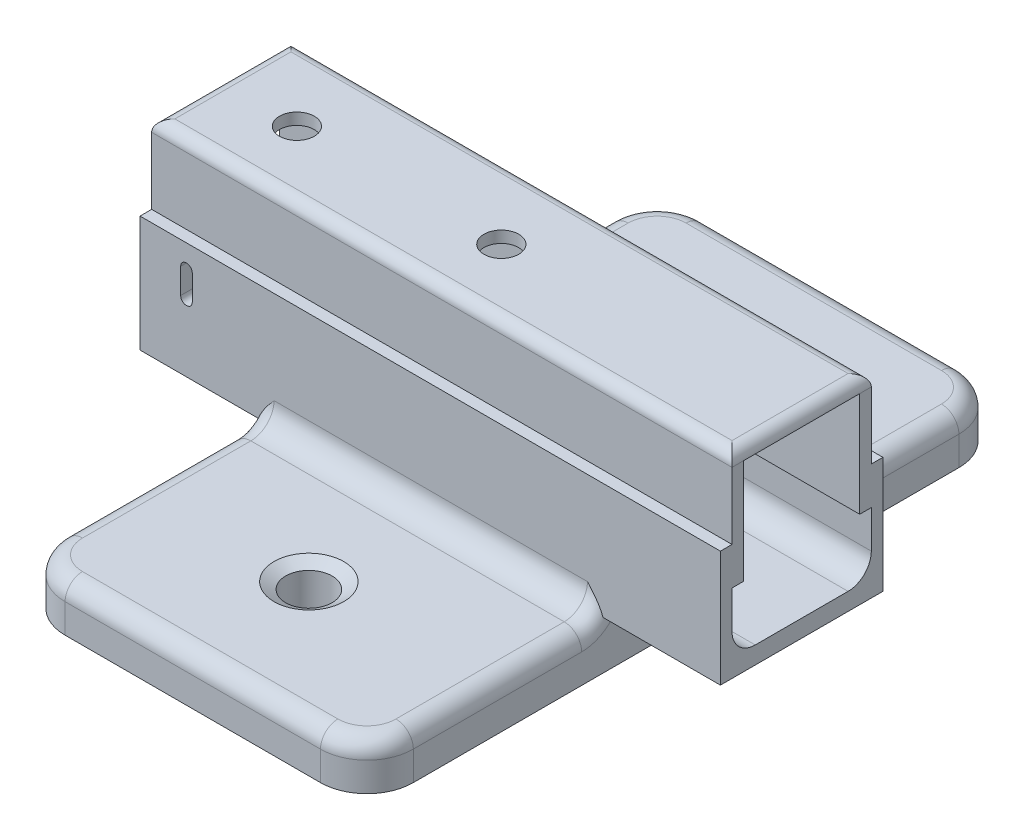
from build123d import *
from OCP.BRepFilletAPI import BRepFilletAPI_MakeChamfer

# Parameters (mm, degrees)
BOSS_EXTRUDE1_DEPTH = 4
SKETCH3_W           = 50
SKETCH3_H           = 1
BOSS_EXTRUDE2_DEPTH = 10
BOSS_EXTRUDE3_START = -13
SKETCH4_W           = 50
SKETCH4_H           = 1.5
BOSS_EXTRUDE3_DEPTH = 12
FILLET1_R           = 2
FILLET2_R           = 2
FILLET3_R           = 2
FILLET4_R           = 1.5
BOSS_EXTRUDE4_DEPTH = 50
FILLET6_START       = -40.045040573
FILLET6_DEPTH       = 50
FILLET6_START_2     = -34.5
FILLET6_2_DEPTH     = 14
SKETCH6_R           = 1.5
CUT_EXTRUDE1_DEPTH  = 2
SKETCH8_R           = 2
CUT_EXTRUDE2_DEPTH  = 10
CHAMFER1_SIZE       = 1
CHAMFER1_SIZE2      = 0.577350269
CUT_EXTRUDE3_DEPTH  = 57.783957087


with BuildPart() as part:
    # Sketch1 → Boss-Extrude1 (new body)
    with BuildSketch(Plane(origin=(0, 0, 0), x_dir=(1, 0, 0), z_dir=(0, 1, 0))):
        with BuildLine():
            Line((-4, 0), (-26, 0))
            ThreePointArc((-26, 0), (-28.828427125, 1.171572875), (-30, 4))
            Line((-30, 4), (-30, 51))
            ThreePointArc((-30, 51), (-28.828427125, 53.828427125), (-26, 55))
            Line((-26, 55), (-4, 55))
            ThreePointArc((-4, 55), (-1.171572875, 53.828427125), (0, 51))
            Line((0, 51), (0, 4))
            ThreePointArc((0, 4), (-1.171572875, 1.171572875), (-4, 0))
        make_face()
    extrude(amount=BOSS_EXTRUDE1_DEPTH)

    # Sketch3 → Boss-Extrude2 (add)
    with BuildSketch(Plane(origin=(0, 4, 0), x_dir=(1, 0, 0), z_dir=(0, 1, 0))):
        with Locations((-15.045040573, 21)):
            Rectangle(SKETCH3_W, SKETCH3_H)
        with Locations((-15.045040573, 34)):
            Rectangle(SKETCH3_W, SKETCH3_H)
    extrude(amount=BOSS_EXTRUDE2_DEPTH)

    # Sketch4 → Boss-Extrude3 (add)
    with BuildSketch(Plane(origin=(0, 0, -34.5), x_dir=(-1, 0, 0), z_dir=(0, 0, -1)).offset(BOSS_EXTRUDE3_START)):
        with Locations((15.045040573, 4.75)):
            Rectangle(SKETCH4_W, SKETCH4_H)
    extrude(amount=BOSS_EXTRUDE3_DEPTH)

    # Fillet1
    fillet1_edges = [part.edges().sort_by_distance(p)[0] for p in [
        (-15, 4, -20.5),
    ]]
    fillet(fillet1_edges, radius=FILLET1_R)

    # Fillet2
    fillet2_edges = [part.edges().sort_by_distance(p)[0] for p in [
        (-15, 4, -34.5),
    ]]
    fillet(fillet2_edges, radius=FILLET2_R)

    # Fillet3
    fillet3_edges = [part.edges().sort_by_distance(p)[0] for p in [
        (-15.045040573, 5.5, -33.5),
        (-15.045040573, 5.5, -21.5),
    ]]
    fillet(fillet3_edges, radius=FILLET3_R)

    # Fillet4
    # the kernel refuses this fillet: 1.5 mm, written as the material it takes off along each edge
    with BuildSketch(Plane(origin=(0, 6, -36.5), x_dir=(0, -1, 0), z_dir=(0, 0, -1))) as fillet4_piece_1_section:
        with BuildLine():
            CenterArc((2 + FILLET4_R, FILLET4_R), FILLET4_R, 180, 90)
            Line((2 + FILLET4_R, 0), (2, 0))
            Line((2, 0), (2, FILLET4_R))
        make_face()
    fillet4_piece_1 = revolve(axis=Axis((0, 6, -36.5), (-1, 0, 0)), revolution_arc=197.472741928, mode=Mode.PRIVATE)
    fillet4_piece_1 = split(fillet4_piece_1, bisect_by=Plane(origin=(0, 6, -34.5), z_dir=(0, 0, -1)), keep=Keep.TOP, mode=Mode.PRIVATE)
    add(fillet4_piece_1, mode=Mode.SUBTRACT)
    with BuildSketch(Plane(origin=(0, 6, -36.5), x_dir=(0, -1, 0), z_dir=(0, 0, -1))) as fillet4_piece_2_section:
        with BuildLine():
            CenterArc((2 + FILLET4_R, FILLET4_R), FILLET4_R, 180, 90)
            Line((2 + FILLET4_R, 0), (2, 0))
            Line((2, 0), (2, FILLET4_R))
        make_face()
    fillet4_piece_2 = revolve(axis=Axis((0, 6, -36.5), (-1, 0, 0)), revolution_arc=197.472741928, mode=Mode.PRIVATE)
    fillet4_piece_2 = split(fillet4_piece_2, bisect_by=Plane(origin=(0, 4, -36.5), z_dir=(0, -1, 0)), keep=Keep.TOP, mode=Mode.PRIVATE)
    add(fillet4_piece_2, mode=Mode.SUBTRACT)
    with BuildSketch(Plane(origin=(-30, 6, -36.5), x_dir=(0, -1, 0), z_dir=(0, 0, -1))) as fillet4_piece_3_section:
        with BuildLine():
            CenterArc((2 + FILLET4_R, -FILLET4_R), FILLET4_R, 90, 90)
            Line((2, -FILLET4_R), (2, 0))
            Line((2, 0), (2 + FILLET4_R, 0))
        make_face()
    fillet4_piece_3 = revolve(axis=Axis((-30, 6, -36.5), (-1, 0, 0)), revolution_arc=197.472741928, mode=Mode.PRIVATE)
    fillet4_piece_3 = split(fillet4_piece_3, bisect_by=Plane(origin=(-30, 4, -36.5), z_dir=(0, -1, 0)), keep=Keep.TOP, mode=Mode.PRIVATE)
    add(fillet4_piece_3, mode=Mode.SUBTRACT)
    with BuildSketch(Plane(origin=(-30, 6, -36.5), x_dir=(0, -1, 0), z_dir=(0, 0, -1))) as fillet4_piece_4_section:
        with BuildLine():
            CenterArc((2 + FILLET4_R, -FILLET4_R), FILLET4_R, 90, 90)
            Line((2, -FILLET4_R), (2, 0))
            Line((2, 0), (2 + FILLET4_R, 0))
        make_face()
    fillet4_piece_4 = revolve(axis=Axis((-30, 6, -36.5), (-1, 0, 0)), revolution_arc=197.472741928, mode=Mode.PRIVATE)
    fillet4_piece_4 = split(fillet4_piece_4, bisect_by=Plane(origin=(-30, 6, -34.5), z_dir=(0, 0, -1)), keep=Keep.TOP, mode=Mode.PRIVATE)
    add(fillet4_piece_4, mode=Mode.SUBTRACT)
    with BuildSketch(Plane(origin=(-30, 6, -18.5), x_dir=(0, 0.9538599015249878, 0.30025204122993193), z_dir=(0, -0.30025204122993193, 0.9538599015249878))) as fillet4_piece_5_section:
        with BuildLine():
            CenterArc((2 + FILLET4_R, -FILLET4_R), FILLET4_R, 90, 90)
            Line((2, -FILLET4_R), (2, 0))
            Line((2, 0), (2 + FILLET4_R, 0))
        make_face()
    fillet4_piece_5 = revolve(axis=Axis((-30, 6, -18.5), (-1, 0, 0)), revolution_arc=197.472741928, mode=Mode.PRIVATE)
    fillet4_piece_5 = split(fillet4_piece_5, bisect_by=Plane(origin=(-30, 6, -20.5), z_dir=(0, 0, 1)), keep=Keep.TOP, mode=Mode.PRIVATE)
    add(fillet4_piece_5, mode=Mode.SUBTRACT)
    with BuildSketch(Plane(origin=(-30, 6, -18.5), x_dir=(0, 0.9538599015249878, 0.30025204122993193), z_dir=(0, -0.30025204122993193, 0.9538599015249878))) as fillet4_piece_6_section:
        with BuildLine():
            CenterArc((2 + FILLET4_R, -FILLET4_R), FILLET4_R, 90, 90)
            Line((2, -FILLET4_R), (2, 0))
            Line((2, 0), (2 + FILLET4_R, 0))
        make_face()
    fillet4_piece_6 = revolve(axis=Axis((-30, 6, -18.5), (-1, 0, 0)), revolution_arc=197.472741928, mode=Mode.PRIVATE)
    fillet4_piece_6 = split(fillet4_piece_6, bisect_by=Plane(origin=(-30, 4, -18.5), z_dir=(0, -1, 0)), keep=Keep.TOP, mode=Mode.PRIVATE)
    add(fillet4_piece_6, mode=Mode.SUBTRACT)
    with BuildSketch(Plane(origin=(0, 6, -18.5), x_dir=(0, 0.9538599015249878, 0.3002520412299318), z_dir=(0, -0.3002520412299318, 0.9538599015249878))) as fillet4_piece_7_section:
        with BuildLine():
            CenterArc((2 + FILLET4_R, FILLET4_R), FILLET4_R, 180, 90)
            Line((2, FILLET4_R), (2, 0))
            Line((2, 0), (2 + FILLET4_R, 0))
        make_face()
    fillet4_piece_7 = revolve(axis=Axis((0, 6, -18.5), (-1, 0, 0)), revolution_arc=197.472741928, mode=Mode.PRIVATE)
    fillet4_piece_7 = split(fillet4_piece_7, bisect_by=Plane(origin=(0, 6, -20.5), z_dir=(0, 0, 1)), keep=Keep.TOP, mode=Mode.PRIVATE)
    add(fillet4_piece_7, mode=Mode.SUBTRACT)
    with BuildSketch(Plane(origin=(0, 6, -18.5), x_dir=(0, 0.9538599015249878, 0.3002520412299318), z_dir=(0, -0.3002520412299318, 0.9538599015249878))) as fillet4_piece_8_section:
        with BuildLine():
            CenterArc((2 + FILLET4_R, FILLET4_R), FILLET4_R, 180, 90)
            Line((2, FILLET4_R), (2, 0))
            Line((2, 0), (2 + FILLET4_R, 0))
        make_face()
    fillet4_piece_8 = revolve(axis=Axis((0, 6, -18.5), (-1, 0, 0)), revolution_arc=197.472741928, mode=Mode.PRIVATE)
    fillet4_piece_8 = split(fillet4_piece_8, bisect_by=Plane(origin=(0, 4, -18.5), z_dir=(0, -1, 0)), keep=Keep.TOP, mode=Mode.PRIVATE)
    add(fillet4_piece_8, mode=Mode.SUBTRACT)
    with BuildSketch(Plane(origin=(-26, 4, -51), x_dir=(-1, 0, 0), z_dir=(0, 0, 1))) as fillet4_piece_9:
        with BuildLine():
            CenterArc((4 - FILLET4_R, FILLET4_R), FILLET4_R, 270, 90)
            Line((4, FILLET4_R), (4, 0))
            Line((4, 0), (4 - FILLET4_R, 0))
        make_face()
    revolve(axis=Axis((-26, 4, -51), (0, -1, 0)), revolution_arc=90, mode=Mode.SUBTRACT)
    with BuildSketch(Plane(origin=(-26, 4, -55), x_dir=(0, 0, 1), z_dir=(1, 0, 0)), Plane(origin=(-4, 4, 0), x_dir=(0, 0, -1), z_dir=(-1, 0, 0))) as fillet4_piece_10:
        with BuildLine():
            CenterArc((FILLET4_R, FILLET4_R), FILLET4_R, 180, 90)
            Line((0, FILLET4_R), (0, 0))
            Line((0, 0), (FILLET4_R, 0))
        make_face()
    extrude(amount=22, mode=Mode.SUBTRACT)
    with BuildSketch(Plane(origin=(-4, 4, -51), x_dir=(0, 0, -1), z_dir=(-1, 0, 0))) as fillet4_piece_11:
        with BuildLine():
            CenterArc((4 - FILLET4_R, FILLET4_R), FILLET4_R, 270, 90)
            Line((4, FILLET4_R), (4, 0))
            Line((4, 0), (4 - FILLET4_R, 0))
        make_face()
    revolve(axis=Axis((-4, 4, -51), (0, -1, 0)), revolution_arc=90, mode=Mode.SUBTRACT)
    with BuildSketch(Plane(origin=(0, 4, -51), x_dir=(0, -1, 0), z_dir=(0, 0, 1)), Plane(origin=(-30, 4, -36.5), x_dir=(0, -1, 0), z_dir=(0, 0, -1)), Plane(origin=(-30, 4, -4), x_dir=(0, -1, 0), z_dir=(0, 0, -1)), Plane(origin=(0, 4, -18.5), x_dir=(0, -1, 0), z_dir=(0, 0, 1))) as fillet4_piece_12:
        with BuildLine():
            CenterArc((FILLET4_R, -FILLET4_R), FILLET4_R, 90, 90)
            Line((0, -FILLET4_R), (0, 0))
            Line((0, 0), (FILLET4_R, 0))
        make_face()
    extrude(amount=14.5, mode=Mode.SUBTRACT)
    with BuildSketch(Plane(origin=(-4, 4, -4), x_dir=(1, 0, 0), z_dir=(0, 0, -1))) as fillet4_piece_13:
        with BuildLine():
            CenterArc((4 - FILLET4_R, FILLET4_R), FILLET4_R, 270, 90)
            Line((4, FILLET4_R), (4, 0))
            Line((4, 0), (4 - FILLET4_R, 0))
        make_face()
    revolve(axis=Axis((-4, 4, -4), (0, -1, 0)), revolution_arc=90, mode=Mode.SUBTRACT)
    with BuildSketch(Plane(origin=(-26, 4, -4), x_dir=(0, 0, 1), z_dir=(1, 0, 0))) as fillet4_piece_14:
        with BuildLine():
            CenterArc((4 - FILLET4_R, FILLET4_R), FILLET4_R, 270, 90)
            Line((4 - FILLET4_R, 0), (4, 0))
            Line((4, 0), (4, FILLET4_R))
        make_face()
    revolve(axis=Axis((-26, 4, -4), (0, -1, 0)), revolution_arc=90, mode=Mode.SUBTRACT)

    # Sketch5 → Boss-Extrude4 (add)
    with BuildSketch(Plane(origin=(9.954959427, 0, 0), x_dir=(0, 0, -1), z_dir=(1, 0, 0))):
        Polygon((21.5, 10.75), (21.5, 20.75), (33.5, 20.75), (33.5, 10.75), (32.5, 10.75), (32.5, 19.75), (22.5, 19.75), (22.5, 10.75), align=None)
    extrude(amount=-BOSS_EXTRUDE4_DEPTH)

    # Fillet6: read off the stored shape, not the designer's step
    # Fillet6 outline → Fillet6 (cut)
    with BuildSketch(Plane.YZ.offset(FILLET6_START)):
        with BuildLine():
            ThreePointArc((19.75, -21.5), (20.457106781, -21.792893219), (20.75, -22.5))
            Line((20.75, -22.5), (20.75, -21.5))
            Line((20.75, -21.5), (19.75, -21.5))
        make_face()
        with BuildLine():
            ThreePointArc((20.75, -32.5), (20.457106781, -33.207106781), (19.75, -33.5))
            Line((19.75, -33.5), (20.75, -33.5))
            Line((20.75, -33.5), (20.75, -32.5))
        make_face()
    extrude(amount=FILLET6_DEPTH, mode=Mode.SUBTRACT)

    # Fillet6 2 outline → Fillet6 2 (cut)
    with BuildSketch(Plane.XY.offset(FILLET6_START_2)):
        with BuildLine():
            Line((-40.045040573, 20.75), (-40.045040573, 19.75))
            ThreePointArc((-40.045040573, 19.75), (-39.752147354, 20.457106781), (-39.045040573, 20.75))
            Line((-39.045040573, 20.75), (-40.045040573, 20.75))
        make_face()
        with BuildLine():
            Line((9.954959427, 20.75), (8.954959427, 20.75))
            ThreePointArc((8.954959427, 20.75), (9.662066208, 20.457106781), (9.954959427, 19.75))
            Line((9.954959427, 19.75), (9.954959427, 20.75))
        make_face()
    extrude(amount=FILLET6_2_DEPTH, mode=Mode.SUBTRACT)

    # Sketch6 → Cut-Extrude1 (cut)
    with BuildSketch(Plane(origin=(0, 20.75, 0), x_dir=(1, 0, 0), z_dir=(0, 1, 0))):
        with Locations(Location((-15.628742291, 27.209372309, 0), (0, 0, 270))):
            Circle(SKETCH6_R)
        with Locations(Location((-33.241009351, 27.209372309, 0), (0, 0, 270))):
            Circle(SKETCH6_R)
    extrude(amount=-CUT_EXTRUDE1_DEPTH, mode=Mode.SUBTRACT)

    # Sketch8 → Cut-Extrude2 (cut)
    with BuildSketch(Plane(origin=(0, 4, 0), x_dir=(1, 0, 0), z_dir=(0, 1, 0))):
        with Locations(Location((-15.5, 10.5, 0), (0, 0, 270))):
            Circle(SKETCH8_R)
        with Locations(Location((-15.5, 44.5, 0), (0, 0, 270))):
            Circle(SKETCH8_R)
    extrude(amount=-CUT_EXTRUDE2_DEPTH, mode=Mode.SUBTRACT)

    # Chamfer1: one chamfer whose edges measure the first distance from different faces: ONE call of the kernel's chamfer builder (chamfer() names one face for all edges)
    chamfer1_edges_1 = [part.edges().sort_by_distance(p)[0] for p in [
        (-15.5, 4, -12.5),
    ]]
    chamfer1_side_1 = [part.faces().sort_by_distance(p)[0] for p in [
        (-15, 4, -1.819061123),
    ]]
    chamfer1_edges_2 = [part.edges().sort_by_distance(p)[0] for p in [
        (-15.5, 4, -46.5),
    ]]
    chamfer1_side_2 = [part.faces().sort_by_distance(p)[0] for p in [
        (-15, 4, -36.819061123),
    ]]
    chamfer1 = BRepFilletAPI_MakeChamfer(part.part.solid().wrapped)
    for e in chamfer1_edges_1:
        chamfer1.Add(CHAMFER1_SIZE, CHAMFER1_SIZE2, e.wrapped, chamfer1_side_1[0].wrapped)  # the first distance lies on this face
    for e in chamfer1_edges_2:
        chamfer1.Add(CHAMFER1_SIZE, CHAMFER1_SIZE2, e.wrapped, chamfer1_side_2[0].wrapped)  # the first distance lies on this face
    add(Compound.cast(chamfer1.Shape()), mode=Mode.REPLACE)

    # Sketch9 → Cut-Extrude3 (cut, through all)
    with BuildSketch(Plane.XY.offset(-20.5)):
        with BuildLine():
            Line((-35.545040573, 12), (-35.545040573, 9.822550729))
            ThreePointArc((-35.545040573, 9.822550729), (-36.045040573, 9.322550729), (-36.545040573, 9.822550729))
            Line((-36.545040573, 9.822550729), (-36.545040573, 12))
            ThreePointArc((-36.545040573, 12), (-36.045040573, 12.5), (-35.545040573, 12))
        make_face()
    extrude(amount=-CUT_EXTRUDE3_DEPTH, mode=Mode.SUBTRACT)


solid = part.part
